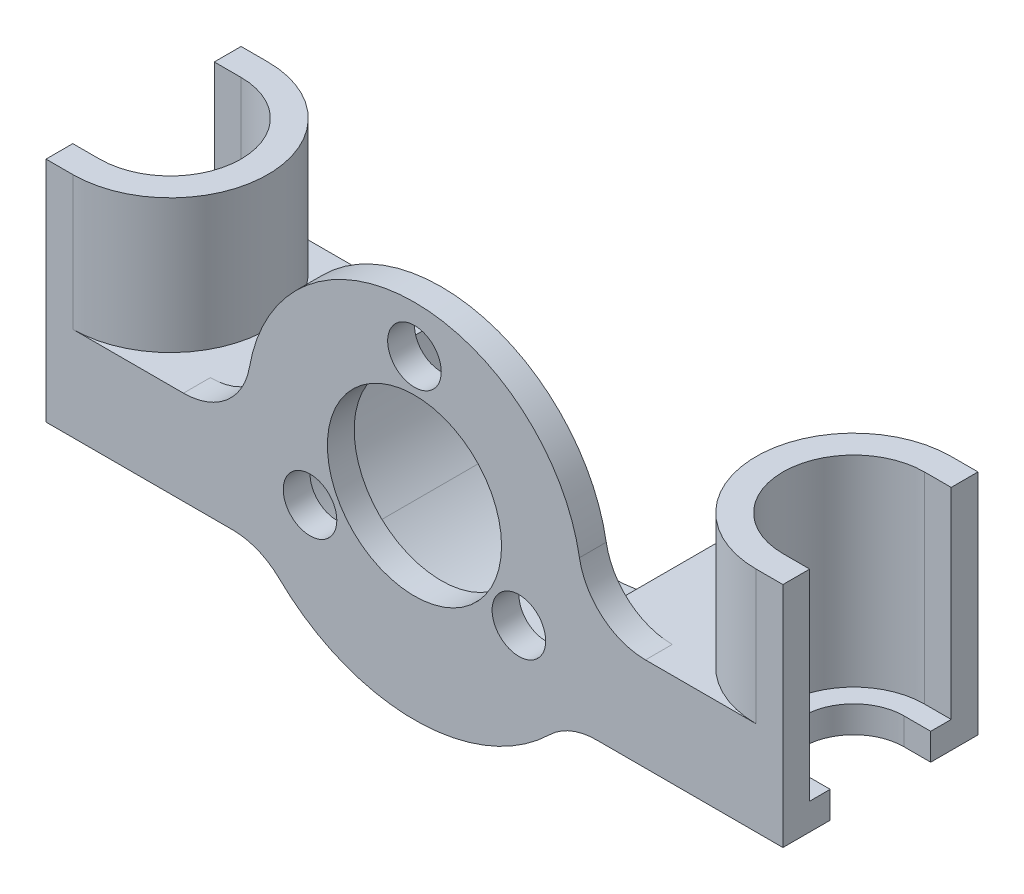
from build123d import *

# Parameters (mm, degrees)
BOSS_EXTRU_1_DEPTH      = 7
BOSS_EXTRU_3_DEPTH      = 2
ESQUISSE2_RX            = 12.5
ESQUISSE2_RY            = 12.5
ENL_V_MAT_EXTRU_1_DEPTH = 40.69604363
ESQUISSE3_R             = 12.5
ESQUISSE3_R_2           = 6.5
ESQUISSE3_R_3           = 2
BOSS_EXTRU_2_DEPTH      = 2
BOSS_EXTRU_4_DEPTH      = 14.56
CONG_2_R                = 5
BOSS_EXTRU_5_DEPTH      = 10


with BuildPart() as part:
    # Esquisse1 → Boss.-Extru.1 (new body)
    with BuildSketch(Plane(origin=(0, 0, 0), x_dir=(1, 0, 0), z_dir=(0, 1, 0))):
        with BuildLine():
            Line((36.259926639, -6.254535912), (36.259926639, -8.254535912))
            Line((36.259926639, -8.254535912), (28.259926639, -8.254535912))
            Line((28.259926639, -8.254535912), (26.259926639, -8.254535912))
            Line((26.259926639, -8.254535912), (-8.740073361, -8.254535912))
            Line((-8.740073361, -8.254535912), (-10.740073361, -8.254535912))
            Line((-10.740073361, -8.254535912), (-18.740073361, -8.254535912))
            Line((-18.740073361, -8.254535912), (-18.740073361, -6.254535912))
            Line((-18.740073361, -6.254535912), (-16.740073361, -6.254535912))
            ThreePointArc((-16.740073361, -6.254535912), (-13.378645093, -5.04629229), (-11.555635108, -1.974535912))
            ThreePointArc((-11.555635108, -1.974535912), (-11.460073361, -0.974535912), (-11.555635108, 0.025464088))
            ThreePointArc((-11.555635108, 0.025464088), (-13.378645093, 3.097220466), (-16.740073361, 4.305464088))
            Line((-16.740073361, 4.305464088), (-18.740073361, 4.305464088))
            Line((-18.740073361, 4.305464088), (-18.740073361, 6.305464088))
            Line((-18.740073361, 6.305464088), (-10.740073361, 6.305464088))
            Line((-10.740073361, 6.305464088), (-8.740073361, 6.305464088))
            Line((-8.740073361, 6.305464088), (26.259926639, 6.305464088))
            Line((26.259926639, 6.305464088), (28.259926639, 6.305464088))
            Line((28.259926639, 6.305464088), (36.259926639, 6.305464088))
            Line((36.259926639, 6.305464088), (36.259926639, 4.305464088))
            Line((36.259926639, 4.305464088), (34.259926639, 4.305464088))
            ThreePointArc((34.259926639, 4.305464088), (30.898498371, 3.097220466), (29.075488386, 0.025464088))
            ThreePointArc((29.075488386, 0.025464088), (28.979926639, -0.974535912), (29.075488386, -1.974535912))
            ThreePointArc((29.075488386, -1.974535912), (30.898498371, -5.04629229), (34.259926639, -6.254535912))
            Line((34.259926639, -6.254535912), (36.259926639, -6.254535912))
        make_face()
    extrude(amount=BOSS_EXTRU_1_DEPTH)

    # Esquisse4 → Boss.-Extru.3 (add)
    with BuildSketch(Plane.XZ):
        with BuildLine():
            Line((34.259926639, 4.724535912), (36.259926639, 4.724535912))
            Line((36.259926639, 4.724535912), (36.259926639, 6.254535912))
            Line((36.259926639, 6.254535912), (34.259926639, 6.254535912))
            ThreePointArc((34.259926639, 6.254535912), (28.979926639, 0.974535912), (34.259926639, -4.305464088))
            Line((34.259926639, -4.305464088), (36.259926639, -4.305464088))
            Line((36.259926639, -4.305464088), (36.259926639, -2.775464088))
            Line((36.259926639, -2.775464088), (34.259926639, -2.775464088))
            ThreePointArc((34.259926639, -2.775464088), (30.509926639, 0.974535912), (34.259926639, 4.724535912))
        make_face()
        with BuildLine():
            Line((-18.740073361, -2.775464088), (-18.740073361, -4.305464088))
            Line((-18.740073361, -4.305464088), (-16.740073361, -4.305464088))
            ThreePointArc((-16.740073361, -4.305464088), (-11.460073361, 0.974535912), (-16.740073361, 6.254535912))
            Line((-16.740073361, 6.254535912), (-18.740073361, 6.254535912))
            Line((-18.740073361, 6.254535912), (-18.740073361, 4.724535912))
            Line((-18.740073361, 4.724535912), (-16.740073361, 4.724535912))
            ThreePointArc((-16.740073361, 4.724535912), (-12.990073361, 0.974535912), (-16.740073361, -2.775464088))
            Line((-16.740073361, -2.775464088), (-18.740073361, -2.775464088))
        make_face()
    extrude(amount=-BOSS_EXTRU_3_DEPTH)

    # Esquisse2 → Enlèv. mat.-Extru.1 (cut, through all)
    with BuildSketch(Plane.XY.offset(8.254535912)):
        with Locations(Location((8.759926639, 9), (0, 0, 180))):
            Ellipse(ESQUISSE2_RX, ESQUISSE2_RY)
    extrude(amount=-ENL_V_MAT_EXTRU_1_DEPTH, mode=Mode.SUBTRACT)


with BuildPart() as enl_v_mat_extru_1_piece_1:
    # of the separate pieces the step leaves, piece 1, a body of its own (enl_v_mat_extru_1_pieces)
    add(part.part.solids().sort_by_distance((-18.740073361, 7, -6.305464088))[0])

    # Esquisse3 → Boss.-Extru.2 (add)
    with BuildSketch(Plane.XY.offset(8.254535912)):
        with Locations((8.759926639, 9)):
            Circle(ESQUISSE3_R)
        with Locations((8.759926639, 9)):
            Circle(ESQUISSE3_R_2, mode=Mode.SUBTRACT)
        with Locations((8.759926639, 18)):
            Circle(ESQUISSE3_R_3, mode=Mode.SUBTRACT)
        with Locations((16.554155273, 4.5)):
            Circle(ESQUISSE3_R_3, mode=Mode.SUBTRACT)
        with Locations((0.965698005, 4.5)):
            Circle(ESQUISSE3_R_3, mode=Mode.SUBTRACT)
    extrude(amount=-BOSS_EXTRU_2_DEPTH)



with BuildPart() as enl_v_mat_extru_1_piece_2:
    # of the separate pieces the step leaves, piece 2, a body of its own (enl_v_mat_extru_1_pieces)
    add(part.part.solids().sort_by_distance((34.259926639, 2, 6.254535912))[0])


with BuildPart() as enl_v_mat_extru_1_piece_1_1:
    add(enl_v_mat_extru_1_piece_1.part)

    add(enl_v_mat_extru_1_piece_2.part)  # Boss.-Extru.4 merges Enlèv. mat.-Extru.1 piece 2
    # Esquisse6 → Boss.-Extru.4 (add)
    with BuildSketch(Plane.XY.offset(8.254535912)):
        with BuildLine():
            Line((0.085250852, 0), (-2.608890362, 0))
            ThreePointArc((-2.608890362, 0), (8.759926639, -5.5), (20.12874364, 0))
            Line((20.12874364, 0), (17.434602425, 0))
            ThreePointArc((17.434602425, 0), (8.759926639, -3.5), (0.085250852, 0))
        make_face()
    extrude(amount=-BOSS_EXTRU_4_DEPTH)

    # Congé2
    # the kernel refuses this fillet: 5 mm, written as the material it adds along each edge
    with BuildSketch(Plane(origin=(20.12874364, 0, 8.254535912), x_dir=(1, 0, 0), z_dir=(0, 0, -1))) as cong_2_piece_1:
        with BuildLine():
            CenterArc((2.20505496, 5), CONG_2_R, 225.885381452, 44.114618548)
            ThreePointArc((-1.27542503, 1.41025641), (-0.614570897, 0.726057307), (0, 0))
            Line((0, 0), (2.20505496, 0))
        make_face()
    extrude(amount=14.56)
    with BuildSketch(Plane(origin=(-2.608890362, 0, 8.254535912), x_dir=(0.6707625728642448, -0.7416721451184065, 0), z_dir=(0, 0, -1))) as cong_2_piece_2:
        with BuildLine():
            CenterArc((2.229292388, 4.989240706), CONG_2_R, 222.125947854, 44.114618548)
            Line((-1.479068338, 1.635427842), (0, 0))
            ThreePointArc((0, 0), (0.950727636, 0.031201952), (1.901455272, 0))
        make_face()
    extrude(amount=14.56)
    with BuildSketch(Plane(origin=(21.098889318, 7, 6.254535912), x_dir=(1, 0, 0), z_dir=(0, 0, 1))) as cong_2_piece_3:
        with BuildLine():
            CenterArc((4.90197697, 5), CONG_2_R, 189.870889606, 80.129110394)
            ThreePointArc((-0.024005787, 4.142857143), (0.160827475, 2.072430037), (0, 0))
            Line((0, 0), (4.90197697, 0))
        make_face()
    extrude(amount=2)
    with BuildSketch(Plane(origin=(-3.579036041, 7, 6.254535912), x_dir=(0.005794402962949308, 0.9999832123062381, 0), z_dir=(0, 0, 1))) as cong_2_piece_4:
        with BuildLine():
            CenterArc((4.971512032, 4.930866692), CONG_2_R, 180.331996692, 80.129110394)
            Line((-0.02840403, 4.901894677), (0, 0))
            ThreePointArc((0, 0), (2.071463347, 0.172833269), (4.142926693, 0))
        make_face()
    extrude(amount=2)

    # Esquisse7 → Boss.-Extru.5 (add)
    with BuildSketch(Plane(origin=(0, 7, 0), x_dir=(1, 0, 0), z_dir=(0, 1, 0))):
        with BuildLine():
            Line((36.259926639, -8.254535912), (36.259926639, -6.254535912))
            Line((36.259926639, -6.254535912), (34.259926639, -6.254535912))
            ThreePointArc((34.259926639, -6.254535912), (28.979926639, -0.974535912), (34.259926639, 4.305464088))
            Line((34.259926639, 4.305464088), (36.259926639, 4.305464088))
            Line((36.259926639, 4.305464088), (36.259926639, 6.305464088))
            Line((36.259926639, 6.305464088), (34.259926639, 6.305464088))
            ThreePointArc((34.259926639, 6.305464088), (26.979926639, -0.974535912), (34.259926639, -8.254535912))
            Line((34.259926639, -8.254535912), (36.259926639, -8.254535912))
        make_face()
        with BuildLine():
            Line((-18.740073361, 6.305464088), (-16.740073361, 6.305464088))
            ThreePointArc((-16.740073361, 6.305464088), (-9.460073361, -0.974535912), (-16.740073361, -8.254535912))
            Line((-16.740073361, -8.254535912), (-18.740073361, -8.254535912))
            Line((-18.740073361, -8.254535912), (-18.740073361, -6.254535912))
            Line((-18.740073361, -6.254535912), (-16.740073361, -6.254535912))
            ThreePointArc((-16.740073361, -6.254535912), (-11.460073361, -0.974535912), (-16.740073361, 4.305464088))
            Line((-16.740073361, 4.305464088), (-18.740073361, 4.305464088))
            Line((-18.740073361, 4.305464088), (-18.740073361, 6.305464088))
        make_face()
    extrude(amount=BOSS_EXTRU_5_DEPTH)


solid = enl_v_mat_extru_1_piece_1_1.part
